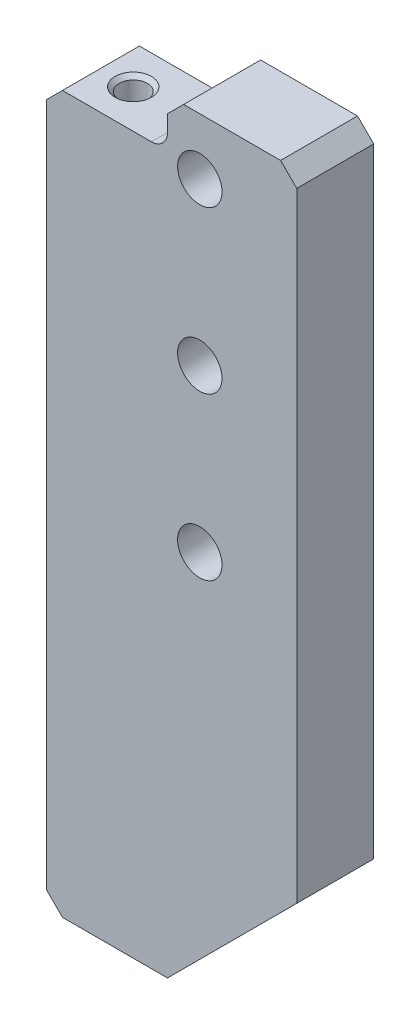
from build123d import *

# Parameters (mm, degrees)
BOSS_EXTRUDE1_DEPTH      = 4.7625
BOSS_EXTRUDE1_DEPTH_BACK = 4.7625
SKETCH1_R                = 2.75
CHAMFER1_SIZE            = 2
CHAMFER2_SIZE            = 0.5
FILLET1_R                = 2


with BuildPart() as part:
    # Sketch1 → Boss-Extrude1 (new, two sides: drawn at the far end of the back side and taken through both)
    with BuildSketch(Plane.XY.offset(-BOSS_EXTRUDE1_DEPTH_BACK)):
        Polygon((-161.247691321, 18.552308679), (-176.247691321, 18.552308679), (-176.247691321, 107.192388155), (-161.247691321, 107.192388155), (-161.247691321, 113.192388155), (-145.247691321, 113.192388155), (-145.247691321, 34.552308679), align=None)
        with Locations((-157.247691321, 66.192388155)):
            Circle(SKETCH1_R, mode=Mode.SUBTRACT)
        with Locations((-157.247691321, 86.192388155)):
            Circle(SKETCH1_R, mode=Mode.SUBTRACT)
        with Locations((-157.247691321, 106.192388155)):
            Circle(SKETCH1_R, mode=Mode.SUBTRACT)
    extrude(amount=BOSS_EXTRUDE1_DEPTH + BOSS_EXTRUDE1_DEPTH_BACK)

    # Sketch2 → Cut-Revolve1 (revolve, cut)
    with BuildSketch(Plane.XY):
        Polygon((-170.247691321, 107.192388155), (-171.997691321, 107.192388155), (-171.997691321, 102.192388155), (-171.447691321, 101.874845507), (-171.447691321, 87.019183075), (-170.247691321, 86.326362752), align=None)
    revolve(axis=Axis((-170.247691321, 107.192388155, 0), (0, -1, 0)), mode=Mode.SUBTRACT)

    # Chamfer1
    chamfer1_edges = [part.edges().sort_by_distance(p)[0] for p in [
        (-176.247691321, 18.552308679, 0),
        (-145.247691321, 113.192388155, 0),
        (-161.247691321, 113.192388155, 0),
        (-176.247691321, 107.192388155, 0),
    ]]
    chamfer(chamfer1_edges, length=CHAMFER1_SIZE)

    # Chamfer2
    chamfer2_edges = [part.edges().sort_by_distance(p)[0] for p in [
        (-168.497691321, 107.192388155, 0),
    ]]
    chamfer(chamfer2_edges, length=CHAMFER2_SIZE)

    # Fillet1
    fillet1_edges = [part.edges().sort_by_distance(p)[0] for p in [
        (-161.247691321, 107.192388155, 0),
    ]]
    fillet(fillet1_edges, radius=FILLET1_R)


solid = part.part
